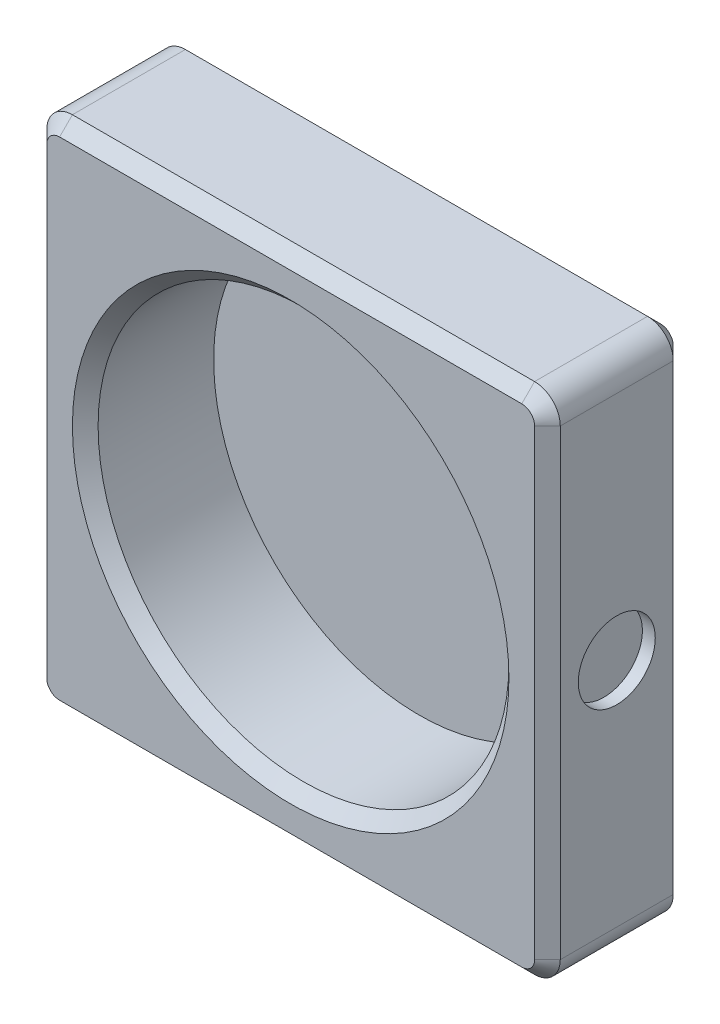
from build123d import *

# Parameters (mm, degrees)
SKETCH1_W           = 20
SKETCH1_H           = 20
BOSS_EXTRUDE1_DEPTH = 5.4
SKETCH2_R           = 8
CUT_EXTRUDE1_DEPTH  = 5
SKETCH3_R           = 1.5
CUT_EXTRUDE2_DEPTH  = 0.5
FILLET1_R           = 1
CHAMFER1_SIZE       = 0.5


with BuildPart() as part:
    # Sketch1 → Boss-Extrude1 (new body)
    with BuildSketch(Plane.XY):
        Rectangle(SKETCH1_W, SKETCH1_H)
    extrude(amount=BOSS_EXTRUDE1_DEPTH)

    # Sketch2 → Cut-Extrude1 (cut)
    with BuildSketch(Plane.XY.offset(5.4)):
        Circle(SKETCH2_R)
    extrude(amount=-CUT_EXTRUDE1_DEPTH, mode=Mode.SUBTRACT)

    # Sketch3 → Cut-Extrude2 (cut)
    with BuildSketch(Plane(origin=(10, 0, 0), x_dir=(0, 0, -1), z_dir=(1, 0, 0))):
        with Locations((-2.7, 0)):
            Circle(SKETCH3_R)
    extrude(amount=-CUT_EXTRUDE2_DEPTH, mode=Mode.SUBTRACT)

    # Fillet1
    fillet1_edges = [part.edges().sort_by_distance(p)[0] for p in [
        (10, -10, 2.7),
        (-10, -10, 2.7),
        (-10, 10, 2.7),
        (10, 10, 2.7),
    ]]
    fillet(fillet1_edges, radius=FILLET1_R)

    # Chamfer1
    chamfer1_edges = [part.edges().sort_by_distance(p)[0] for p in [
        (9.707106781, 9.707106781, 0),
        (0, 10, 0),
        (-9.707106781, 9.707106781, 0),
        (-10, 0, 0),
        (-9.707106781, -9.707106781, 0),
        (0, -10, 0),
        (9.707106781, -9.707106781, 0),
        (10, 0, 0),
        (-9.707106781, -9.707106781, 5.4),
        (-10, 0, 5.4),
        (-9.707106781, 9.707106781, 5.4),
        (0, 10, 5.4),
        (9.707106781, 9.707106781, 5.4),
        (10, 0, 5.4),
        (9.707106781, -9.707106781, 5.4),
        (0, -10, 5.4),
        (-8, 0, 5.4),
    ]]
    chamfer(chamfer1_edges, length=CHAMFER1_SIZE)


solid = part.part
